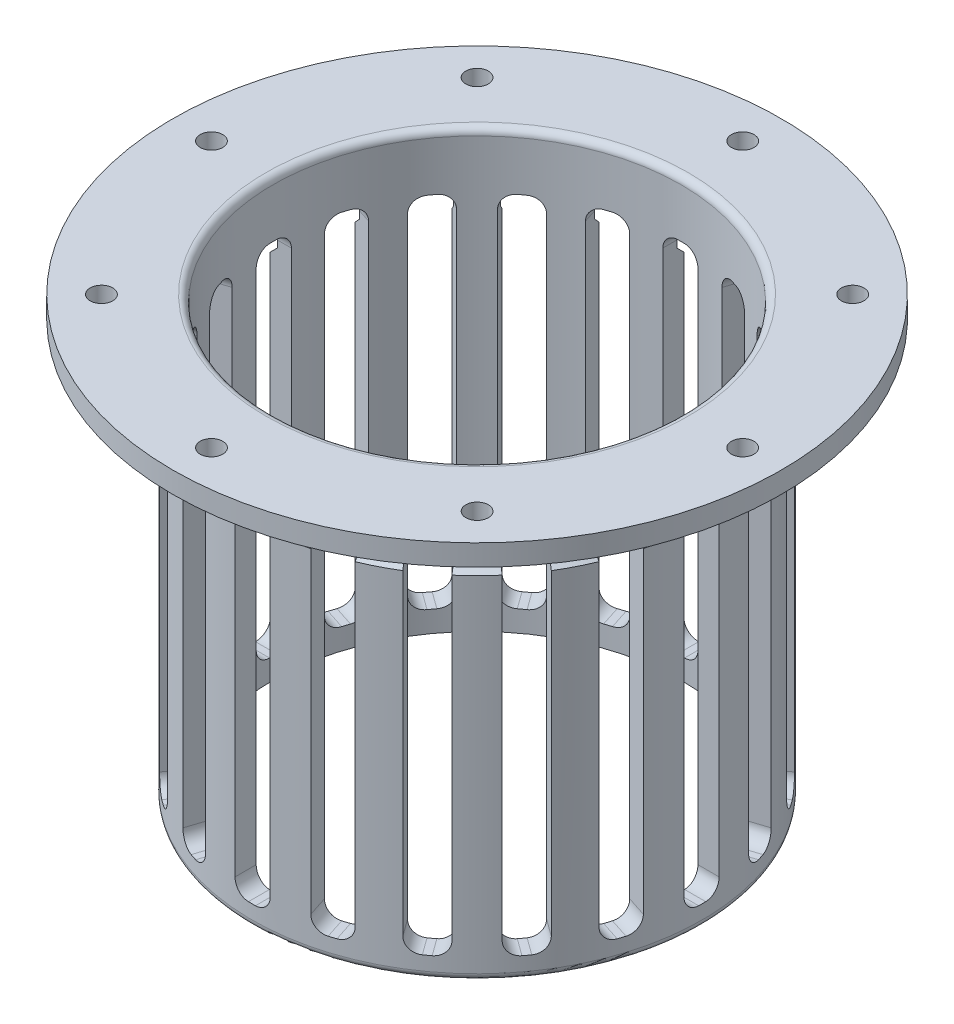
from build123d import *

# Parameters (mm, degrees)
SKETCH1_R                = 43.25
SKETCH1_R_2              = 32
SKETCH1_R_3              = 1.6
BOSS_EXTRUDE1_DEPTH      = 3
BOSS_EXTRUDE2_DEPTH      = 5
BOSS_EXTRUDE2_DEPTH_BACK = 3
SKETCH2_R                = 32
SKETCH2_R_2              = 29
SKETCH3_R                = 31
SKETCH3_R_2              = 29
BOSS_EXTRUDE3_DEPTH      = 4
SKETCH4_R                = 32
SKETCH4_R_2              = 29
BOSS_EXTRUDE4_DEPTH      = 50
SKETCH5_W                = 5
SKETCH5_H                = 51
CUT_EXTRUDE1_DEPTH       = 50
FILLET1_R                = 2
CIRPATTERN1_COUNT        = 20
FILLET1_OF_CIRPATTERN1_R = 2
FILLET2_R                = 1
CHAMFER1_SIZE            = 1
FILLET3_R                = 1


with BuildPart() as part:
    # Sketch1 → Boss-Extrude1 (new body)
    with BuildSketch(Plane(origin=(0, 0, 0), x_dir=(1, 0, 0), z_dir=(0, 1, 0))):
        with Locations(Location((0, 0, 0), (0, 0, 270))):
            Circle(SKETCH1_R)
        with Locations(Location((0, 0, 0), (0, 0, 270))):
            Circle(SKETCH1_R_2, mode=Mode.SUBTRACT)
        with Locations(Location((0, 37.75, 0), (0, 0, 270))):
            Circle(SKETCH1_R_3, mode=Mode.SUBTRACT)
        with Locations(Location((26.69328099, 26.69328099, 0), (0, 0, 270))):
            Circle(SKETCH1_R_3, mode=Mode.SUBTRACT)
        with Locations(Location((37.75, 0, 0), (0, 0, 270))):
            Circle(SKETCH1_R_3, mode=Mode.SUBTRACT)
        with Locations(Location((26.69328099, -26.69328099, 0), (0, 0, 270))):
            Circle(SKETCH1_R_3, mode=Mode.SUBTRACT)
        with Locations(Location((0, -37.75, 0), (0, 0, 270))):
            Circle(SKETCH1_R_3, mode=Mode.SUBTRACT)
        with Locations(Location((-26.69328099, -26.69328099, 0), (0, 0, 270))):
            Circle(SKETCH1_R_3, mode=Mode.SUBTRACT)
        with Locations(Location((-37.75, 0, 0), (0, 0, 270))):
            Circle(SKETCH1_R_3, mode=Mode.SUBTRACT)
        with Locations(Location((-26.69328099, 26.69328099, 0), (0, 0, 270))):
            Circle(SKETCH1_R_3, mode=Mode.SUBTRACT)
    extrude(amount=BOSS_EXTRUDE1_DEPTH)

    # Sketch2 → Boss-Extrude2 (add, two sides: drawn at the far end of the back side and taken through both)
    with BuildSketch(Plane.XZ.offset(-BOSS_EXTRUDE2_DEPTH_BACK)):
        with Locations(Location((0, 0, 0), (0, 0, 270))):
            Circle(SKETCH2_R)
        with Locations(Location((0, 0, 0), (0, 0, 270))):
            Circle(SKETCH2_R_2, mode=Mode.SUBTRACT)
    extrude(amount=BOSS_EXTRUDE2_DEPTH + BOSS_EXTRUDE2_DEPTH_BACK)

    # Sketch3 → Boss-Extrude3 (add)
    with BuildSketch(Plane.XZ.offset(5)):
        with Locations(Location((0, 0, 0), (0, 0, 270))):
            Circle(SKETCH3_R)
        with Locations(Location((0, 0, 0), (0, 0, 270))):
            Circle(SKETCH3_R_2, mode=Mode.SUBTRACT)
    extrude(amount=BOSS_EXTRUDE3_DEPTH)

    # Sketch4 → Boss-Extrude4 (add)
    with BuildSketch(Plane.XZ.offset(9)):
        with Locations(Location((0, 0, 0), (0, 0, 270))):
            Circle(SKETCH4_R)
        with Locations(Location((0, 0, 0), (0, 0, 270))):
            Circle(SKETCH4_R_2, mode=Mode.SUBTRACT)
    extrude(amount=BOSS_EXTRUDE4_DEPTH)

    # Sketch5 → Cut-Extrude1 (cut)
    with BuildSketch(Plane(origin=(0, 0, 0), x_dir=(0, 0, -1), z_dir=(1, 0, 0))):
        with Locations((0, -30.5)):
            Rectangle(SKETCH5_W, SKETCH5_H)
    cut_extrude1 = extrude(amount=-CUT_EXTRUDE1_DEPTH, mode=Mode.SUBTRACT)

    # Fillet1
    fillet1_edges = [part.edges().sort_by_distance(p)[0] for p in [
        (-29.895534769, -5, 2.5),
        (-30.397117354, -56, 2.5),
        (-29.895534769, -5, -2.5),
        (-30.397117354, -56, -2.5),
    ]]
    fillet(fillet1_edges, radius=FILLET1_R)

    # CirPattern1: Cut-Extrude1 ×20 about axis
    cirpattern1_axis = Axis((0, 0, 0), (0, 1, 0))
    for i in range(1, CIRPATTERN1_COUNT):
        add(cut_extrude1.rotate(cirpattern1_axis, i * 360 / CIRPATTERN1_COUNT), mode=Mode.SUBTRACT)

    # Fillet1 of CirPattern1
    fillet1_of_cirpattern1_edges = [part.edges().sort_by_distance(p)[0] for p in [
        (-27.659800664, -5, 11.61586959),
        (-28.13683405, -56, 11.770867133),
        (-29.204885636, -5, 6.860587009),
        (-29.681919022, -56, 7.015584552),
        (-22.716532553, -5, 19.594696932),
        (-23.122321389, -56, 19.889519779),
        (-25.655458815, -5, 15.54961196),
        (-26.06124765, -56, 15.844434807),
        (-15.54961196, -5, 25.655458815),
        (-15.844434807, -56, 26.06124765),
        (-19.594696932, -5, 22.716532553),
        (-19.889519779, -56, 23.122321389),
        (-6.860587009, -5, 29.204885636),
        (-7.015584552, -56, 29.681919022),
        (-11.61586959, -5, 27.659800664),
        (-11.770867133, -56, 28.13683405),
        (2.5, -5, 29.895534769),
        (2.5, -56, 30.397117354),
        (-2.5, -5, 29.895534769),
        (-2.5, -56, 30.397117354),
        (11.61586959, -5, 27.659800664),
        (11.770867133, -56, 28.13683405),
        (6.860587009, -5, 29.204885636),
        (7.015584552, -56, 29.681919022),
        (19.594696932, -5, 22.716532553),
        (19.889519779, -56, 23.122321389),
        (15.54961196, -5, 25.655458815),
        (15.844434807, -56, 26.06124765),
        (25.655458815, -5, 15.54961196),
        (26.06124765, -56, 15.844434807),
        (22.716532553, -5, 19.594696932),
        (23.122321389, -56, 19.889519779),
        (29.204885636, -5, 6.860587009),
        (29.681919022, -56, 7.015584552),
        (27.659800664, -5, 11.61586959),
        (28.13683405, -56, 11.770867133),
        (29.895534769, -5, -2.5),
        (30.397117354, -56, -2.5),
        (29.895534769, -5, 2.5),
        (30.397117354, -56, 2.5),
        (27.659800664, -5, -11.61586959),
        (28.13683405, -56, -11.770867133),
        (29.204885636, -5, -6.860587009),
        (29.681919022, -56, -7.015584552),
        (22.716532553, -5, -19.594696932),
        (23.122321389, -56, -19.889519779),
        (25.655458815, -5, -15.54961196),
        (26.06124765, -56, -15.844434807),
        (15.54961196, -5, -25.655458815),
        (15.844434807, -56, -26.06124765),
        (19.594696932, -5, -22.716532553),
        (19.889519779, -56, -23.122321389),
        (6.860587009, -5, -29.204885636),
        (7.015584552, -56, -29.681919022),
        (11.61586959, -5, -27.659800664),
        (11.770867133, -56, -28.13683405),
        (-2.5, -5, -29.895534769),
        (-2.5, -56, -30.397117354),
        (2.5, -5, -29.895534769),
        (2.5, -56, -30.397117354),
        (-11.61586959, -5, -27.659800664),
        (-11.770867133, -56, -28.13683405),
        (-6.860587009, -5, -29.204885636),
        (-7.015584552, -56, -29.681919022),
        (-19.594696932, -5, -22.716532553),
        (-19.889519779, -56, -23.122321389),
        (-15.54961196, -5, -25.655458815),
        (-15.844434807, -56, -26.06124765),
        (-25.655458815, -5, -15.54961196),
        (-26.06124765, -56, -15.844434807),
        (-22.716532553, -5, -19.594696932),
        (-23.122321389, -56, -19.889519779),
        (-29.204885636, -5, -6.860587009),
        (-29.681919022, -56, -7.015584552),
        (-27.659800664, -5, -11.61586959),
        (-28.13683405, -56, -11.770867133),
    ]]
    fillet(fillet1_of_cirpattern1_edges, radius=FILLET1_OF_CIRPATTERN1_R)

    # Fillet2
    fillet2_edges = [part.edges().sort_by_distance(p)[0] for p in [
        (0, 0, 32),
        (0, 3, 29),
    ]]
    fillet(fillet2_edges, radius=FILLET2_R)

    # Chamfer1
    chamfer1_edges = [part.edges().sort_by_distance(p)[0] for p in [
        (27.62120225, -9, -14.073705492),
        (21.920310217, -9, -21.920310217),
        (14.073705492, -9, -27.62120225),
        (4.849468416, -9, -30.618338558),
        (-4.849468416, -9, -30.618338558),
        (30.618338558, -9, -4.849468416),
        (30.618338558, -9, 4.849468416),
        (27.62120225, -9, 14.073705492),
        (21.920310217, -9, 21.920310217),
        (14.073705492, -9, 27.62120225),
        (4.849468416, -9, 30.618338558),
        (-4.849468416, -9, 30.618338558),
        (-14.073705492, -9, 27.62120225),
        (-21.920310217, -9, 21.920310217),
        (-27.62120225, -9, 14.073705492),
        (-30.618338558, -9, 4.849468416),
        (-30.618338558, -9, -4.849468416),
        (-27.62120225, -9, -14.073705492),
        (-21.920310217, -9, -21.920310217),
        (-14.073705492, -9, -27.62120225),
    ]]
    chamfer(chamfer1_edges, length=CHAMFER1_SIZE - 0.0001)  # a hair under: the kernel refuses the full size

    # Fillet3
    fillet3_edges = [part.edges().sort_by_distance(p)[0] for p in [
        (0, -59, 32),
    ]]
    fillet(fillet3_edges, radius=FILLET3_R)


solid = part.part
